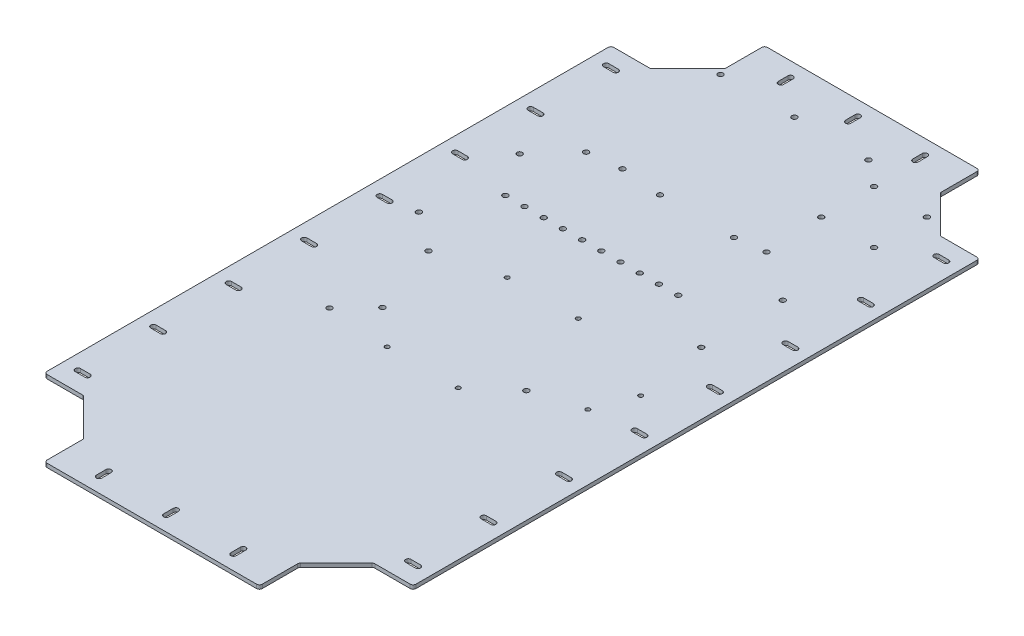
from build123d import *

# Parameters (mm, degrees)
SZKIC1_W                    = 384
SZKIC1_H                    = 750
ODGI_CIE_BAZOWE1_DEPTH      = 4
WYTNIJ_WYCI_GNI_CIE1_DEPTH  = 422.313422525
SZCZELINA_START             = -4
SZCZELINA_POD_RUB_M51_DEPTH = 4
SZCZELINA_POD_RUB_M52_DEPTH = 4
ZAOKR_GLENIE1_R             = 3
SZKIC11_R                   = 2.75
WYTNIJ_WYCI_GNI_CIE2_DEPTH  = 422.313422525
SZKIC12_R                   = 2.75
WYTNIJ_WYCI_GNI_CIE3_DEPTH  = 422.313422525
SZKIC13_R                   = 2.75
WYTNIJ_WYCI_GNI_CIE4_DEPTH  = 422.313422525
SZKIC14_R                   = 2.75
WYTNIJ_WYCI_GNI_CIE5_DEPTH  = 422.313422525
SZYK_LINIOWY1_COUNT         = 10
SZYK_LINIOWY1_PITCH         = 20
SZKIC15_R                   = 2.75
WYTNIJ_WYCI_GNI_CIE6_DEPTH  = 422.313422525
SZKIC16_R                   = 2.25
WYTNIJ_WYCI_GNI_CIE7_DEPTH  = 422.313422525
SZKIC17_R                   = 2.75
WYTNIJ_WYCI_GNI_CIE8_DEPTH  = 422.313422525
SZKIC18_R                   = 2.75
WYTNIJ_WYCI_GNI_CIE9_DEPTH  = 422.313422525
SZKIC19_R                   = 2.25
WYTNIJ_WYCI_GNI_CIE10_DEPTH = 422.313422525


# Read off the part's stored shape, not the designer's step: Szczelina pod śrubę M51, Szczelina pod śrubę M52
# Sheet-metal steps are written as plain solids
with BuildPart() as part:
    # Szkic1 → Odgięcie bazowe1 (new body)
    with BuildSketch(Plane(origin=(0, 0, 0), x_dir=(1, 0, 0), z_dir=(0, 1, 0))):
        Rectangle(SZKIC1_W, SZKIC1_H)
    extrude(amount=-ODGI_CIE_BAZOWE1_DEPTH)

    # Szkic6 → Wytnij-wyciągnięcie1 (cut, through all)
    with BuildSketch(Plane(origin=(0, 0, 0), x_dir=(1, 0, 0), z_dir=(0, 1, 0))):
        Polygon((-112, 375), (-112, 334), (-151, 295), (-192, 295), (-192, 375), align=None)
        Polygon((192, 375), (112, 375), (112, 334), (151, 295), (192, 295), align=None)
        Polygon((112, -375), (112, -334), (151, -295), (192, -295), (192, -375), align=None)
        Polygon((-192, -375), (-112, -375), (-112, -334), (-151, -295), (-192, -295), align=None)
    extrude(amount=-WYTNIJ_WYCI_GNI_CIE1_DEPTH, mode=Mode.SUBTRACT)

    # Szczelina pod śrubę M51 outline → Szczelina pod śrubę M51 (cut)
    with BuildSketch(Plane(origin=(0, 0, 0), x_dir=(1, 0, 0), z_dir=(0, 1, 0)).offset(SZCZELINA_START)):
        with BuildLine():
            Line((-177, -277.75), (-167, -277.75))
            ThreePointArc((-167, -277.75), (-164.25, -275), (-167, -272.25))
            Line((-167, -272.25), (-177, -272.25))
            ThreePointArc((-177, -272.25), (-179.75, -275), (-177, -277.75))
        make_face()
        with BuildLine():
            ThreePointArc((177, -277.75), (179.75, -275), (177, -272.25))
            Line((177, -272.25), (167, -272.25))
            ThreePointArc((167, -272.25), (164.25, -275), (167, -277.75))
            Line((167, -277.75), (177, -277.75))
        make_face()
        with BuildLine():
            Line((-177, -199.178571429), (-167, -199.178571429))
            ThreePointArc((-167, -199.178571429), (-164.25, -196.428571429), (-167, -193.678571429))
            Line((-167, -193.678571429), (-177, -193.678571429))
            ThreePointArc((-177, -193.678571429), (-179.75, -196.428571429), (-177, -199.178571429))
        make_face()
        with BuildLine():
            ThreePointArc((177, -199.178571429), (179.75, -196.428571429), (177, -193.678571429))
            Line((177, -193.678571429), (167, -193.678571429))
            ThreePointArc((167, -193.678571429), (164.25, -196.428571429), (167, -199.178571429))
            Line((167, -199.178571429), (177, -199.178571429))
        make_face()
        with BuildLine():
            Line((-177, -120.607142857), (-167, -120.607142857))
            ThreePointArc((-167, -120.607142857), (-164.25, -117.857142857), (-167, -115.107142857))
            Line((-167, -115.107142857), (-177, -115.107142857))
            ThreePointArc((-177, -115.107142857), (-179.75, -117.857142857), (-177, -120.607142857))
        make_face()
        with BuildLine():
            ThreePointArc((177, -120.607142857), (179.75, -117.857142857), (177, -115.107142857))
            Line((177, -115.107142857), (167, -115.107142857))
            ThreePointArc((167, -115.107142857), (164.25, -117.857142857), (167, -120.607142857))
            Line((167, -120.607142857), (177, -120.607142857))
        make_face()
        with BuildLine():
            Line((-177, -42.035714286), (-167, -42.035714286))
            ThreePointArc((-167, -42.035714286), (-164.25, -39.285714286), (-167, -36.535714286))
            Line((-167, -36.535714286), (-177, -36.535714286))
            ThreePointArc((-177, -36.535714286), (-179.75, -39.285714286), (-177, -42.035714286))
        make_face()
        with BuildLine():
            ThreePointArc((177, -42.035714286), (179.75, -39.285714286), (177, -36.535714286))
            Line((177, -36.535714286), (167, -36.535714286))
            ThreePointArc((167, -36.535714286), (164.25, -39.285714286), (167, -42.035714286))
            Line((167, -42.035714286), (177, -42.035714286))
        make_face()
        with BuildLine():
            Line((-177, 36.535714286), (-167, 36.535714286))
            ThreePointArc((-167, 36.535714286), (-164.25, 39.285714286), (-167, 42.035714286))
            Line((-167, 42.035714286), (-177, 42.035714286))
            ThreePointArc((-177, 42.035714286), (-179.75, 39.285714286), (-177, 36.535714286))
        make_face()
        with BuildLine():
            ThreePointArc((177, 36.535714286), (179.75, 39.285714286), (177, 42.035714286))
            Line((177, 42.035714286), (167, 42.035714286))
            ThreePointArc((167, 42.035714286), (164.25, 39.285714286), (167, 36.535714286))
            Line((167, 36.535714286), (177, 36.535714286))
        make_face()
        with BuildLine():
            Line((-177, 115.107142857), (-167, 115.107142857))
            ThreePointArc((-167, 115.107142857), (-164.25, 117.857142857), (-167, 120.607142857))
            Line((-167, 120.607142857), (-177, 120.607142857))
            ThreePointArc((-177, 120.607142857), (-179.75, 117.857142857), (-177, 115.107142857))
        make_face()
        with BuildLine():
            ThreePointArc((177, 115.107142857), (179.75, 117.857142857), (177, 120.607142857))
            Line((177, 120.607142857), (167, 120.607142857))
            ThreePointArc((167, 120.607142857), (164.25, 117.857142857), (167, 115.107142857))
            Line((167, 115.107142857), (177, 115.107142857))
        make_face()
        with BuildLine():
            Line((-177, 193.678571429), (-167, 193.678571429))
            ThreePointArc((-167, 193.678571429), (-164.25, 196.428571429), (-167, 199.178571429))
            Line((-167, 199.178571429), (-177, 199.178571429))
            ThreePointArc((-177, 199.178571429), (-179.75, 196.428571429), (-177, 193.678571429))
        make_face()
        with BuildLine():
            ThreePointArc((177, 193.678571429), (179.75, 196.428571429), (177, 199.178571429))
            Line((177, 199.178571429), (167, 199.178571429))
            ThreePointArc((167, 199.178571429), (164.25, 196.428571429), (167, 193.678571429))
            Line((167, 193.678571429), (177, 193.678571429))
        make_face()
        with BuildLine():
            Line((-177, 272.25), (-167, 272.25))
            ThreePointArc((-167, 272.25), (-164.25, 275), (-167, 277.75))
            Line((-167, 277.75), (-177, 277.75))
            ThreePointArc((-177, 277.75), (-179.75, 275), (-177, 272.25))
        make_face()
        with BuildLine():
            ThreePointArc((177, 272.25), (179.75, 275), (177, 277.75))
            Line((177, 277.75), (167, 277.75))
            ThreePointArc((167, 277.75), (164.25, 275), (167, 272.25))
            Line((167, 272.25), (177, 272.25))
        make_face()
    extrude(amount=SZCZELINA_POD_RUB_M51_DEPTH, mode=Mode.SUBTRACT)

    # Szczelina pod śrubę M52 outline → Szczelina pod śrubę M52 (cut)
    with BuildSketch(Plane(origin=(0, 0, 0), x_dir=(1, 0, 0), z_dir=(0, 1, 0)).offset(SZCZELINA_START)):
        with BuildLine():
            Line((-2.760881741, 359.993999601), (-2.739105218, 349.994023312))
            ThreePointArc((-2.739105218, 349.994023312), (0.016876805, 347.250018376), (2.760881741, 350.006000399))
            Line((2.760881741, 350.006000399), (2.739105218, 360.005976688))
            ThreePointArc((2.739105218, 360.005976688), (-0.016876805, 362.749981624), (-2.760881741, 359.993999601))
        make_face()
        with BuildLine():
            Line((-2.760881741, -350.006000399), (-2.739105218, -360.005976688))
            ThreePointArc((-2.739105218, -360.005976688), (0.016876805, -362.749981624), (2.760881741, -359.993999601))
            Line((2.760881741, -359.993999601), (2.739105218, -349.994023312))
            ThreePointArc((2.739105218, -349.994023312), (-0.016876805, -347.250018376), (-2.760881741, -350.006000399))
        make_face()
        with BuildLine():
            Line((-72.760881741, -350.006000399), (-72.739105218, -360.005976688))
            ThreePointArc((-72.739105218, -360.005976688), (-69.983123195, -362.749981624), (-67.239118259, -359.993999601))
            Line((-67.239118259, -359.993999601), (-67.260894782, -349.994023312))
            ThreePointArc((-67.260894782, -349.994023312), (-70.016876805, -347.250018376), (-72.760881741, -350.006000399))
        make_face()
        with BuildLine():
            Line((67.239118259, -350.006000399), (67.260894782, -360.005976688))
            ThreePointArc((67.260894782, -360.005976688), (70.016876805, -362.749981624), (72.760881741, -359.993999601))
            Line((72.760881741, -359.993999601), (72.739105218, -349.994023312))
            ThreePointArc((72.739105218, -349.994023312), (69.983123195, -347.250018376), (67.239118259, -350.006000399))
        make_face()
        with BuildLine():
            Line((67.239118259, 359.993999601), (67.260894782, 349.994023312))
            ThreePointArc((67.260894782, 349.994023312), (70.016876805, 347.250018376), (72.760881741, 350.006000399))
            Line((72.760881741, 350.006000399), (72.739105218, 360.005976688))
            ThreePointArc((72.739105218, 360.005976688), (69.983123195, 362.749981624), (67.239118259, 359.993999601))
        make_face()
        with BuildLine():
            Line((-72.760881741, 359.993999601), (-72.739105218, 349.994023312))
            ThreePointArc((-72.739105218, 349.994023312), (-69.983123195, 347.250018376), (-67.239118259, 350.006000399))
            Line((-67.239118259, 350.006000399), (-67.260894782, 360.005976688))
            ThreePointArc((-67.260894782, 360.005976688), (-70.016876805, 362.749981624), (-72.760881741, 359.993999601))
        make_face()
    extrude(amount=SZCZELINA_POD_RUB_M52_DEPTH, mode=Mode.SUBTRACT)

    # Zaokrąglenie1
    zaokr_glenie1_edges = [part.edges().sort_by_distance(p)[0] for p in [
        (-192, -2, 295),
        (-151, -2, 295),
        (-112, -2, 334),
        (-112, -2, 375),
        (112, -2, 375),
        (112, -2, 334),
        (151, -2, 295),
        (192, -2, 295),
        (192, -2, -295),
        (151, -2, -295),
        (112, -2, -334),
        (112, -2, -375),
        (-112, -2, -375),
        (-112, -2, -334),
        (-151, -2, -295),
        (-192, -2, -295),
    ]]
    fillet(zaokr_glenie1_edges, radius=ZAOKR_GLENIE1_R)

    # Szkic11 → Wytnij-wyciągnięcie2 (cut, through all)
    with BuildSketch(Plane(origin=(0, 0, 0), x_dir=(1, 0, 0), z_dir=(0, 1, 0))):
        with Locations(Location((-32, 186.121320344, 0), (0, 0, 270))):
            Circle(SZKIC11_R)
        with Locations(Location((-32, 326.121320344, 0), (0, 0, 270))):
            Circle(SZKIC11_R)
        with Locations(Location((-109, 326.121320344, 0), (0, 0, 270))):
            Circle(SZKIC11_R)
        with Locations(Location((-109, 186.121320344, 0), (0, 0, 270))):
            Circle(SZKIC11_R)
        with Locations(Location((45, 186.121320344, 0), (0, 0, 270))):
            Circle(SZKIC11_R)
        with Locations(Location((45, 326.121320344, 0), (0, 0, 270))):
            Circle(SZKIC11_R)
    extrude(amount=-WYTNIJ_WYCI_GNI_CIE2_DEPTH, mode=Mode.SUBTRACT)

    # Szkic12 → Wytnij-wyciągnięcie3 (cut, through all)
    with BuildSketch(Plane(origin=(0, 0, 0), x_dir=(1, 0, 0), z_dir=(0, 1, 0))):
        with Locations(Location((72, 305, 0), (0, 0, 270))):
            Circle(SZKIC12_R)
        with Locations(Location((127, 305, 0), (0, 0, 270))):
            Circle(SZKIC12_R)
        with Locations(Location((127, 250, 0), (0, 0, 270))):
            Circle(SZKIC12_R)
        with Locations(Location((72, 250, 0), (0, 0, 270))):
            Circle(SZKIC12_R)
    extrude(amount=-WYTNIJ_WYCI_GNI_CIE3_DEPTH, mode=Mode.SUBTRACT)

    # Szkic13 → Wytnij-wyciągnięcie4 (cut, through all)
    with BuildSketch(Plane(origin=(0, 0, 0), x_dir=(1, 0, 0), z_dir=(0, 1, 0))):
        with Locations(Location((127, 155, 0), (0, 0, 270))):
            Circle(SZKIC13_R)
        with Locations(Location((127, 70, 0), (0, 0, 270))):
            Circle(SZKIC13_R)
    extrude(amount=-WYTNIJ_WYCI_GNI_CIE4_DEPTH, mode=Mode.SUBTRACT)

    # Szkic14 → Wytnij-wyciągnięcie5 (cut, through all)
    with BuildSketch(Plane(origin=(0, 0, 0), x_dir=(1, 0, 0), z_dir=(0, 1, 0))):
        with Locations(Location((-112, 105, 0), (0, 0, 270))):
            Circle(SZKIC14_R)
    wytnij_wyci_gni_cie5 = extrude(amount=-WYTNIJ_WYCI_GNI_CIE5_DEPTH, mode=Mode.SUBTRACT)

    # Szyk liniowy1: Wytnij-wyciągnięcie5 ×10
    with Locations(*[(i * SZYK_LINIOWY1_PITCH, 0, 0) for i in range(1, SZYK_LINIOWY1_COUNT)]):
        add(wytnij_wyci_gni_cie5, mode=Mode.SUBTRACT)

    # Szkic15 → Wytnij-wyciągnięcie6 (cut, through all)
    with BuildSketch(Plane(origin=(0, 0, 0), x_dir=(1, 0, 0), z_dir=(0, 1, 0))):
        with Locations(Location((-142, 150, 0), (0, 0, 270))):
            Circle(SZKIC15_R)
        with Locations(Location((-142, 45, 0), (0, 0, 270))):
            Circle(SZKIC15_R)
    extrude(amount=-WYTNIJ_WYCI_GNI_CIE6_DEPTH, mode=Mode.SUBTRACT)

    # Szkic16 → Wytnij-wyciągnięcie7 (cut, through all)
    with BuildSketch(Plane(origin=(0, 0, 0), x_dir=(1, 0, 0), z_dir=(0, 1, 0))):
        with Locations(Location((139, -5, 0), (0, 0, 270))):
            Circle(SZKIC16_R)
        with Locations(Location((124, -45, 0), (0, 0, 270))):
            Circle(SZKIC16_R)
    extrude(amount=-WYTNIJ_WYCI_GNI_CIE7_DEPTH, mode=Mode.SUBTRACT)

    # Szkic17 → Wytnij-wyciągnięcie8 (cut, through all)
    with BuildSketch(Plane(origin=(0, 0, 0), x_dir=(1, 0, 0), z_dir=(0, 1, 0))):
        with Locations(Location((-75, 190, 0), (0, 0, 270))):
            Circle(SZKIC17_R)
        with Locations(Location((75, 190, 0), (0, 0, 270))):
            Circle(SZKIC17_R)
        with Locations(Location((75, -60, 0), (0, 0, 270))):
            Circle(SZKIC17_R)
        with Locations(Location((-75, -60, 0), (0, 0, 270))):
            Circle(SZKIC17_R)
    extrude(amount=-WYTNIJ_WYCI_GNI_CIE8_DEPTH, mode=Mode.SUBTRACT)

    # Szkic18 → Wytnij-wyciągnięcie9 (cut, through all)
    with BuildSketch(Plane(origin=(0, 0, 0), x_dir=(1, 0, 0), z_dir=(0, 1, 0))):
        with Locations(Location((-102, 15, 0), (0, 0, 270))):
            Circle(SZKIC18_R)
        with Locations(Location((-102, -88, 0), (0, 0, 270))):
            Circle(SZKIC18_R)
    extrude(amount=-WYTNIJ_WYCI_GNI_CIE9_DEPTH, mode=Mode.SUBTRACT)

    # Szkic19 → Wytnij-wyciągnięcie10 (cut, through all)
    with BuildSketch(Plane(origin=(0, 0, 0), x_dir=(1, 0, 0), z_dir=(0, 1, 0))):
        with Locations(Location((-37, 32, 0), (0, 0, 270))):
            Circle(SZKIC19_R)
        with Locations(Location((-37, -93, 0), (0, 0, 270))):
            Circle(SZKIC19_R)
        with Locations(Location((37, -93, 0), (0, 0, 270))):
            Circle(SZKIC19_R)
        with Locations(Location((37, 32, 0), (0, 0, 270))):
            Circle(SZKIC19_R)
    extrude(amount=-WYTNIJ_WYCI_GNI_CIE10_DEPTH, mode=Mode.SUBTRACT)


solid = part.part
